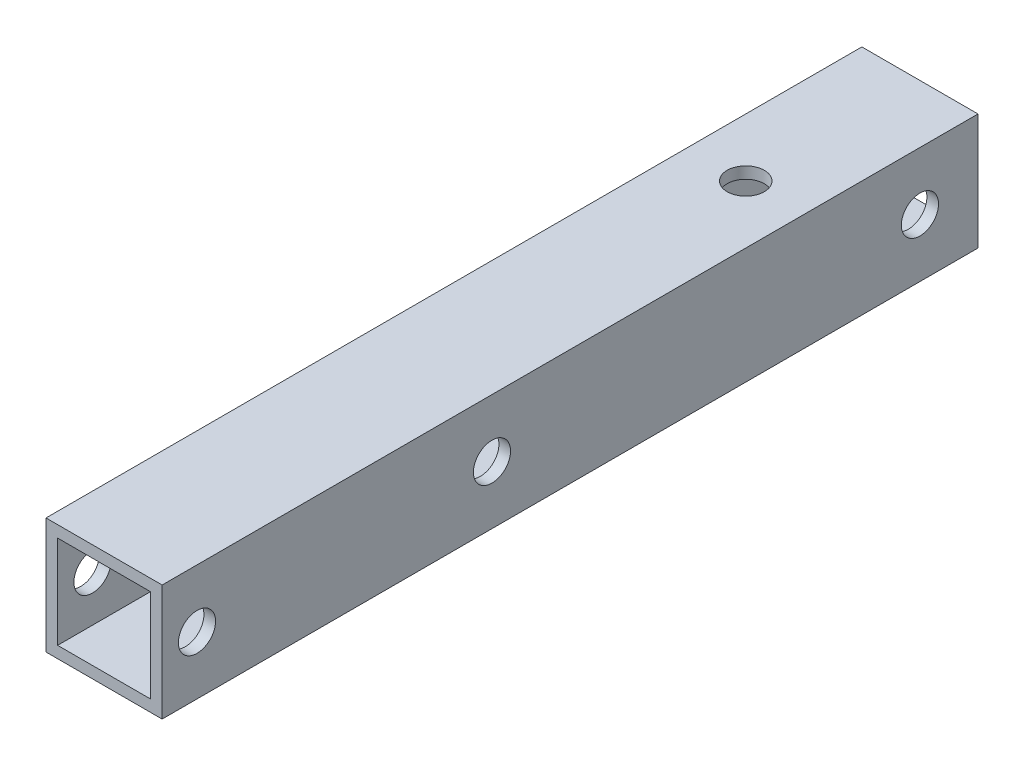
from build123d import *

# Parameters (mm, degrees)
SKETCH_1_W          = 10
SKETCH_1_H          = 10
SKETCH_1_W_2        = 8
SKETCH_1_H_2        = 8
EXTRUDE_1_DEPTH     = 70.25
SKETCH_2_R          = 1.6
CUT_EXTRUDE_1_DEPTH = 72.134116287
SKETCH_3_R          = 1.6
CUT_EXTRUDE_2_DEPTH = 72.134116287


with BuildPart() as part:
    # ｽｹｯﾁ1 → 押し出し-薄板1 (new body)
    with BuildSketch(Plane.XY):
        Rectangle(SKETCH_1_W, SKETCH_1_H)
        Rectangle(SKETCH_1_W_2, SKETCH_1_H_2, mode=Mode.SUBTRACT)
    extrude(amount=EXTRUDE_1_DEPTH)

    # ｽｹｯﾁ2 → ｶｯﾄ - 押し出し1 (cut, through all)
    with BuildSketch(Plane(origin=(0, 5, 0), x_dir=(1, 0, 0), z_dir=(0, 1, 0))):
        with Locations((0, -15)):
            Circle(SKETCH_2_R)
    extrude(amount=-CUT_EXTRUDE_1_DEPTH, mode=Mode.SUBTRACT)

    # ｽｹｯﾁ3 → ｶｯﾄ - 押し出し2 (cut, through all)
    with BuildSketch(Plane(origin=(5, 0, 0), x_dir=(0, 0, -1), z_dir=(1, 0, 0))):
        with Locations((-41.85, 0)):
            Circle(SKETCH_3_R)
        with Locations((-67.25, 0)):
            Circle(SKETCH_3_R)
        with Locations((-5, 0)):
            Circle(SKETCH_3_R)
    extrude(amount=-CUT_EXTRUDE_2_DEPTH, mode=Mode.SUBTRACT)


solid = part.part
